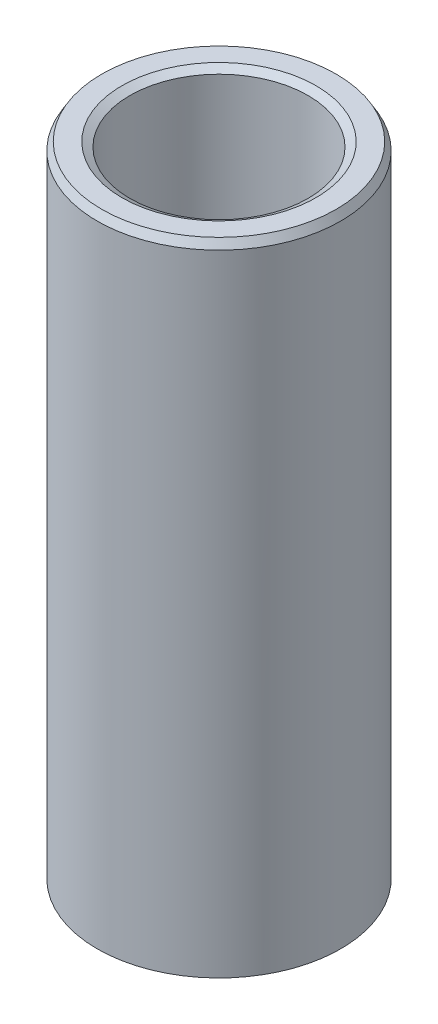
from build123d import *
from OCP.BRepFilletAPI import BRepFilletAPI_MakeChamfer

# Parameters (mm, degrees)
SKETCH1_R           = 52.5
BOSS_EXTRUDE1_DEPTH = 277.143206171
SKETCH2_R           = 38.439597264
CUT_EXTRUDE1_DEPTH  = 287.916114442
CHAMFER1_SIZE       = 3.406098154
CHAMFER1_SIZE2      = 1.966511686


with BuildPart() as part:
    # Sketch1 → Boss-Extrude1 (new body)
    with BuildSketch(Plane(origin=(0, 0, 0), x_dir=(1, 0, 0), z_dir=(0, 1, 0))):
        Circle(SKETCH1_R)
    extrude(amount=BOSS_EXTRUDE1_DEPTH)

    # Sketch2 → Cut-Extrude1 (cut, through all)
    with BuildSketch(Plane(origin=(0, 0, 0), x_dir=(1, 0, 0), z_dir=(0, 1, 0))):
        Circle(SKETCH2_R)
    extrude(amount=CUT_EXTRUDE1_DEPTH, mode=Mode.SUBTRACT)

    # Chamfer1: one chamfer whose edges measure the first distance from different faces: ONE call of the kernel's chamfer builder (chamfer() names one face for all edges)
    chamfer1_edges_1 = [part.edges().sort_by_distance(p)[0] for p in [
        (-38.439597264, 277.143206171, 0),
    ]]
    chamfer1_side_1 = [part.faces().sort_by_distance(p)[0] for p in [
        (-51.01507576, 277.143206171, 0),
    ]]
    chamfer1_edges_2 = [part.edges().sort_by_distance(p)[0] for p in [
        (-38.439597264, 0, 0),
    ]]
    chamfer1_side_2 = [part.faces().sort_by_distance(p)[0] for p in [
        (-38.439597264, 138.571603085, 0),
    ]]
    chamfer1_edges_3 = [part.edges().sort_by_distance(p)[0] for p in [
        (-52.5, 0, 0),
    ]]
    chamfer1_side_3 = [part.faces().sort_by_distance(p)[0] for p in [
        (-51.01507576, 0, 0),
    ]]
    chamfer1_edges_4 = [part.edges().sort_by_distance(p)[0] for p in [
        (-52.5, 277.143206171, 0),
    ]]
    chamfer1_side_4 = [part.faces().sort_by_distance(p)[0] for p in [
        (-52.5, 138.571603085, 0),
    ]]
    chamfer1 = BRepFilletAPI_MakeChamfer(part.part.solid().wrapped)
    for e in chamfer1_edges_1:
        chamfer1.Add(CHAMFER1_SIZE, CHAMFER1_SIZE2, e.wrapped, chamfer1_side_1[0].wrapped)  # the first distance lies on this face
    for e in chamfer1_edges_2:
        chamfer1.Add(CHAMFER1_SIZE, CHAMFER1_SIZE2, e.wrapped, chamfer1_side_2[0].wrapped)  # the first distance lies on this face
    for e in chamfer1_edges_3:
        chamfer1.Add(CHAMFER1_SIZE, CHAMFER1_SIZE2, e.wrapped, chamfer1_side_3[0].wrapped)  # the first distance lies on this face
    for e in chamfer1_edges_4:
        chamfer1.Add(CHAMFER1_SIZE, CHAMFER1_SIZE2, e.wrapped, chamfer1_side_4[0].wrapped)  # the first distance lies on this face
    add(Compound.cast(chamfer1.Shape()), mode=Mode.REPLACE)


solid = part.part
